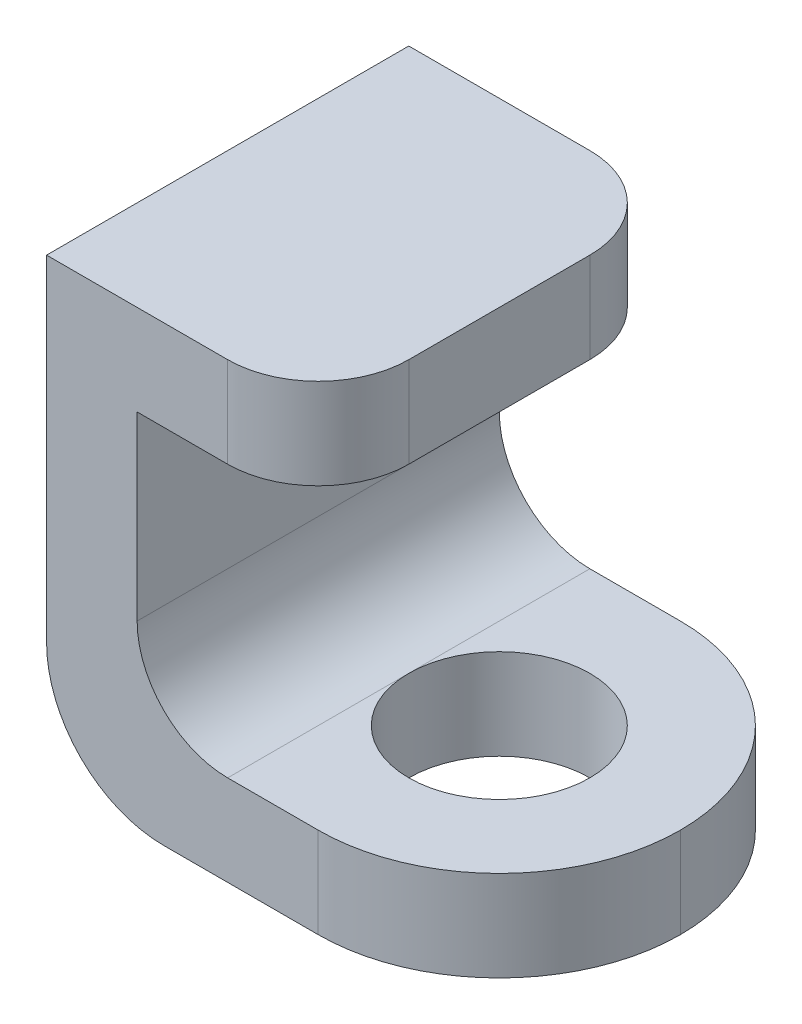
from build123d import *

# Parameters (mm, degrees)
SKETCH_1_W          = 50
SKETCH_1_H          = 40
EXTRUDE_1_DEPTH     = 50
CUT_EXTRUDE_1_DEPTH = 69.738635424
FILLET_1_R          = 10
FILLET_2_R          = 20
SKETCH_4_R          = 10
CUT_EXTRUDE_2_DEPTH = 50


with BuildPart() as part:
    # 草圖1 → 填料-伸長1 (new body)
    with BuildSketch(Plane(origin=(0, 0, 0), x_dir=(1, 0, 0), z_dir=(0, 1, 0))):
        Rectangle(SKETCH_1_W, SKETCH_1_H)
    extrude(amount=EXTRUDE_1_DEPTH)

    # 草圖2 → 除料-伸長1 (cut, through all)
    with BuildSketch(Plane.XY.offset(20)):
        with BuildLine():
            Line((25, 50), (5, 50))
            Line((5, 50), (5, 40))
            Line((5, 40), (-15, 40))
            Line((-15, 40), (-15, 20))
            ThreePointArc((-15, 20), (-12.071067812, 12.928932188), (-5, 10))
            Line((-5, 10), (25, 10))
            Line((25, 10), (25, 50))
        make_face()
        with BuildLine():
            ThreePointArc((-12.071067812, 0), (-21.213203436, 3.786796564), (-25, 12.928932188))
            Line((-25, 12.928932188), (-25, 0))
            Line((-25, 0), (-12.071067812, 0))
        make_face()
    extrude(amount=-CUT_EXTRUDE_1_DEPTH, mode=Mode.SUBTRACT)

    # 圓角1
    fillet_1_edges = [part.edges().sort_by_distance(p)[0] for p in [
        (5, 45, -20),
        (5, 45, 20),
    ]]
    fillet(fillet_1_edges, radius=FILLET_1_R)

    # 圓角2
    fillet_2_edges = [part.edges().sort_by_distance(p)[0] for p in [
        (25, 5, -20),
        (25, 5, 20),
    ]]
    fillet(fillet_2_edges, radius=FILLET_2_R - 0.0001)  # a hair under: the kernel refuses the full size

    # 草圖4 → 除料-伸長2 (cut)
    with BuildSketch(Plane(origin=(0, 10, 0), x_dir=(1, 0, 0), z_dir=(0, 1, 0))):
        with Locations(Location((5, 0, 0), (0, 0, 180))):
            Circle(SKETCH_4_R)
    extrude(amount=-CUT_EXTRUDE_2_DEPTH, mode=Mode.SUBTRACT)


solid = part.part
